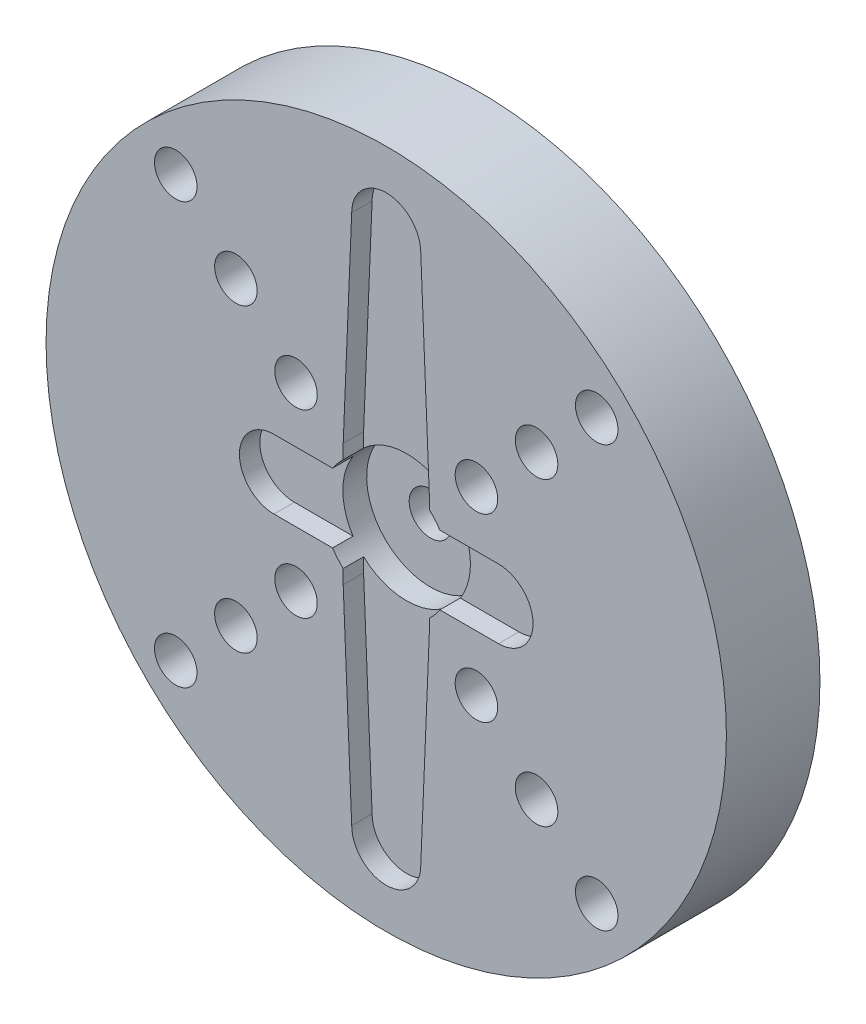
from build123d import *

# Parameters (mm, degrees)
SKETCH1_R               = 20
BOSS_EXTRUDE1_DEPTH     = 4
SKETCH2_R               = 1.25
CUT_EXTRUDE1_DEPTH      = 29.565713714
CAVITY1_START           = 2.8
CAVITY1_OUTLINE_R       = 0.675
CAVITY1_OUTLINE_R_2     = 0.6
CAVITY1_OUTLINE_R_3     = 2.5
CAVITY1_DEPTH           = 1.2
CAVITY1_START_2         = 3.4
CAVITY1_2_OUTLINE_R     = 2.5
CAVITY1_2_OUTLINE_R_2   = 1.25
CAVITY1_2_DEPTH         = 0.6
CUT_EXTRUDE2_START      = -2
CUT_EXTRUDE2_DEPTH      = 2
CUT_EXTRUDE3_START      = -1.2
CUT_EXTRUDE3_DEPTH      = 1.2
CUT_EXTRUDE4_DEPTH      = 1.2
SKETCH6_R               = 1.25
CUT_EXTRUDE5_DEPTH      = 29.565713714
CIRPATTERN1_COUNT       = 4
CUT_EXTRUDE6_DEPTH      = 29.422526278
CUT_EXTRUDE6_DEPTH_BACK = 1.4
SKETCH7_R               = 3.75
SKETCH8_R               = 20
SKETCH8_R_2             = 2.5
SKETCH8_R_3             = 1.25
BOSS_EXTRUDE2_DEPTH     = 1.5


# Read off the part's stored shape, not the designer's step: Cavity1
with BuildPart() as part:
    # Sketch1 → Boss-Extrude1 (new body)
    with BuildSketch(Plane.XY):
        Circle(SKETCH1_R)
    extrude(amount=BOSS_EXTRUDE1_DEPTH)

    # Sketch2 → Cut-Extrude1 (cut, through all)
    with BuildSketch(Plane.XY.offset(4)):
        Circle(SKETCH2_R)
    extrude(amount=-CUT_EXTRUDE1_DEPTH, mode=Mode.SUBTRACT)

    # Cavity1 outline → Cavity1 (cut)
    with BuildSketch(Plane.XY.offset(CAVITY1_START)):
        with BuildLine():
            ThreePointArc((2.993325909, 2), (2.762479071, 2.308399745), (2.5, 2.590366769))
            Line((2.5, 2.590366769), (2.5, 3.6))
            Line((2.5, 3.6), (2, 15.6))
            ThreePointArc((2, 15.6), (0, 17.6), (-2, 15.6))
            Line((-2, 15.6), (-2.5, 3.6))
            Line((-2.5, 3.6), (-2.5, 2.590366769))
            ThreePointArc((-2.5, 2.590366769), (-2.762479071, 2.308399745), (-2.993325909, 2))
            Line((-2.993325909, 2), (-6.6, 2))
            ThreePointArc((-6.6, 2), (-8.6, 0), (-6.6, -2))
            Line((-6.6, -2), (-2.993325909, -2))
            ThreePointArc((-2.993325909, -2), (-2.762479071, -2.308399745), (-2.5, -2.590366769))
            Line((-2.5, -2.590366769), (-2.5, -3.6))
            Line((-2.5, -3.6), (-2, -15.6))
            ThreePointArc((-2, -15.6), (0, -17.6), (2, -15.6))
            Line((2, -15.6), (2.5, -3.6))
            Line((2.5, -3.6), (2.5, -2.590366769))
            ThreePointArc((2.5, -2.590366769), (2.762479071, -2.308399745), (2.993325909, -2))
            Line((2.993325909, -2), (6.6, -2))
            ThreePointArc((6.6, -2), (8.6, 0), (6.6, 2))
            Line((6.6, 2), (2.993325909, 2))
        make_face()
        with Locations((0, -15.6)):
            Circle(CAVITY1_OUTLINE_R, mode=Mode.SUBTRACT)
        with Locations((0, -13.4)):
            Circle(CAVITY1_OUTLINE_R, mode=Mode.SUBTRACT)
        with Locations((0, -11.2)):
            Circle(CAVITY1_OUTLINE_R, mode=Mode.SUBTRACT)
        with Locations((0, -9)):
            Circle(CAVITY1_OUTLINE_R, mode=Mode.SUBTRACT)
        with Locations((0, -6.8)):
            Circle(CAVITY1_OUTLINE_R, mode=Mode.SUBTRACT)
        with Locations((0, -4.6)):
            Circle(CAVITY1_OUTLINE_R, mode=Mode.SUBTRACT)
        with Locations((-6.6, 0)):
            Circle(CAVITY1_OUTLINE_R_2, mode=Mode.SUBTRACT)
        with Locations((-4.6, 0)):
            Circle(CAVITY1_OUTLINE_R_2, mode=Mode.SUBTRACT)
        Circle(CAVITY1_OUTLINE_R_3, mode=Mode.SUBTRACT)
        with Locations((0, 4.6)):
            Circle(CAVITY1_OUTLINE_R, mode=Mode.SUBTRACT)
        with Locations((0, 6.8)):
            Circle(CAVITY1_OUTLINE_R, mode=Mode.SUBTRACT)
        with Locations((4.6, 0)):
            Circle(CAVITY1_OUTLINE_R_2, mode=Mode.SUBTRACT)
        with Locations((6.6, 0)):
            Circle(CAVITY1_OUTLINE_R_2, mode=Mode.SUBTRACT)
        with Locations((0, 9)):
            Circle(CAVITY1_OUTLINE_R, mode=Mode.SUBTRACT)
        with Locations((0, 11.2)):
            Circle(CAVITY1_OUTLINE_R, mode=Mode.SUBTRACT)
        with Locations((0, 13.4)):
            Circle(CAVITY1_OUTLINE_R, mode=Mode.SUBTRACT)
        with Locations((0, 15.6)):
            Circle(CAVITY1_OUTLINE_R, mode=Mode.SUBTRACT)
    extrude(amount=CAVITY1_DEPTH, mode=Mode.SUBTRACT)

    # Cavity1 2 outline → Cavity1 2 (cut)
    with BuildSketch(Plane.XY.offset(CAVITY1_START_2)):
        Circle(CAVITY1_2_OUTLINE_R)
        Circle(CAVITY1_2_OUTLINE_R_2, mode=Mode.SUBTRACT)
    extrude(amount=CAVITY1_2_DEPTH, mode=Mode.SUBTRACT)

    # Sketch3 → Cut-Extrude2 (cut)
    with BuildSketch(Plane.XY.offset(3.4).offset(CUT_EXTRUDE2_START)):
        with BuildLine():
            ThreePointArc((-2.5, 0), (0, -2.5), (2.5, 0))
            ThreePointArc((2.5, 0), (0, 2.5), (-2.5, 0))
        make_face()
    extrude(amount=CUT_EXTRUDE2_DEPTH, mode=Mode.SUBTRACT)

    # Sketch4 → Cut-Extrude3 (cut)
    with BuildSketch(Plane.XY.offset(4).offset(CUT_EXTRUDE3_START)):
        with BuildLine():
            Line((-6.6, -2), (-2.993325909, -2))
            ThreePointArc((-2.993325909, -2), (-2.762479071, -2.308399745), (-2.5, -2.590366769))
            Line((-2.5, -2.590366769), (-2.5, -3.6))
            Line((-2.5, -3.6), (-2, -15.6))
            ThreePointArc((-2, -15.6), (0, -17.6), (2, -15.6))
            Line((2, -15.6), (2.5, -3.6))
            Line((2.5, -3.6), (2.5, -2.590366769))
            ThreePointArc((2.5, -2.590366769), (2.762479071, -2.308399745), (2.993325909, -2))
            Line((2.993325909, -2), (6.6, -2))
            ThreePointArc((6.6, -2), (8.6, 0), (6.6, 2))
            Line((6.6, 2), (2.993325909, 2))
            ThreePointArc((2.993325909, 2), (2.762479071, 2.308399745), (2.5, 2.590366769))
            Line((2.5, 2.590366769), (2.5, 3.6))
            Line((2.5, 3.6), (2, 15.6))
            ThreePointArc((2, 15.6), (0, 17.6), (-2, 15.6))
            Line((-2, 15.6), (-2.5, 3.6))
            Line((-2.5, 3.6), (-2.5, 2.590366769))
            ThreePointArc((-2.5, 2.590366769), (-2.762479071, 2.308399745), (-2.993325909, 2))
            Line((-2.993325909, 2), (-6.6, 2))
            ThreePointArc((-6.6, 2), (-8.6, 0), (-6.6, -2))
        make_face()
    extrude(amount=CUT_EXTRUDE3_DEPTH, mode=Mode.SUBTRACT)

    # Sketch5 → Cut-Extrude4 (cut)
    with BuildSketch(Plane.XY.offset(4)):
        with BuildLine():
            Line((-6.6, -2.03), (-3.00931886, -2.03))
            ThreePointArc((-3.00931886, -2.03), (-2.784441978, -2.328901645), (-2.53, -2.603075105))
            Line((-2.53, -2.603075105), (-2.53, -3.600624729))
            Line((-2.53, -3.600624729), (-2.029999903, -15.600627053))
            ThreePointArc((-2.029999903, -15.600627053), (0, -17.63), (2.029999903, -15.600627053))
            Line((2.029999903, -15.600627053), (2.53, -3.600624729))
            Line((2.53, -3.600624729), (2.53, -2.603075105))
            ThreePointArc((2.53, -2.603075105), (2.784441978, -2.328901645), (3.00931886, -2.03))
            Line((3.00931886, -2.03), (6.6, -2.03))
            ThreePointArc((6.6, -2.03), (8.63, 0), (6.6, 2.03))
            Line((6.6, 2.03), (3.00931886, 2.03))
            ThreePointArc((3.00931886, 2.03), (2.784441978, 2.328901645), (2.53, 2.603075105))
            Line((2.53, 2.603075105), (2.53, 3.600624729))
            Line((2.53, 3.600624729), (2.029999903, 15.600627053))
            ThreePointArc((2.029999903, 15.600627053), (0, 17.63), (-2.029999903, 15.600627053))
            Line((-2.029999903, 15.600627053), (-2.53, 3.600624729))
            Line((-2.53, 3.600624729), (-2.53, 2.603075105))
            ThreePointArc((-2.53, 2.603075105), (-2.784441978, 2.328901645), (-3.00931886, 2.03))
            Line((-3.00931886, 2.03), (-6.6, 2.03))
            ThreePointArc((-6.6, 2.03), (-8.63, 0), (-6.6, -2.03))
        make_face()
    extrude(amount=-CUT_EXTRUDE4_DEPTH, mode=Mode.SUBTRACT)

    # Sketch6 → Cut-Extrude5 (cut, through all)
    with BuildSketch(Plane.XY.offset(4)):
        with Locations((5.303300859, 5.303300859)):
            Circle(SKETCH6_R)
        with Locations((8.838834765, 8.838834765)):
            Circle(SKETCH6_R)
        with Locations((12.374368671, 12.374368671)):
            Circle(SKETCH6_R)
    cut_extrude5 = extrude(amount=-CUT_EXTRUDE5_DEPTH, mode=Mode.SUBTRACT)

    # CirPattern1: Cut-Extrude5 ×4 about axis
    cirpattern1_axis = Axis((0, 0, 0), (0, 0, 1))
    for i in range(1, CIRPATTERN1_COUNT):
        add(cut_extrude5.rotate(cirpattern1_axis, i * 360 / CIRPATTERN1_COUNT), mode=Mode.SUBTRACT)

    # Sketch7 → Cut-Extrude6 (cut, two sides: drawn at the far end of the back side and taken through both)
    with BuildSketch(Plane.XY.offset(2.8).offset(-CUT_EXTRUDE6_DEPTH_BACK)):
        with Locations(Location((0, 0, 0), (0, 0, 147.225549173))):
            Circle(SKETCH7_R)
    extrude(amount=CUT_EXTRUDE6_DEPTH + CUT_EXTRUDE6_DEPTH_BACK, mode=Mode.SUBTRACT)

    # Sketch8 → Boss-Extrude2 (add)
    with BuildSketch(Plane(origin=(0, 0, 0), x_dir=(-1, 0, 0), z_dir=(0, 0, -1))):
        Circle(SKETCH8_R)
        Circle(SKETCH8_R_2, mode=Mode.SUBTRACT)
        with Locations(Location((12.374368671, 12.374368671, 0), (0, 0, 90))):
            Circle(SKETCH8_R_3, mode=Mode.SUBTRACT)
        with Locations(Location((-12.374368671, 12.374368671, 0), (0, 0, 180))):
            Circle(SKETCH8_R_3, mode=Mode.SUBTRACT)
        with Locations(Location((-8.838834765, 8.838834765, 0), (0, 0, 180))):
            Circle(SKETCH8_R_3, mode=Mode.SUBTRACT)
        with Locations(Location((-5.303300859, 5.303300859, 0), (0, 0, 180))):
            Circle(SKETCH8_R_3, mode=Mode.SUBTRACT)
        with Locations((12.374368671, -12.374368671)):
            Circle(SKETCH8_R_3, mode=Mode.SUBTRACT)
        with Locations((8.838834765, -8.838834765)):
            Circle(SKETCH8_R_3, mode=Mode.SUBTRACT)
        with Locations((5.303300859, -5.303300859)):
            Circle(SKETCH8_R_3, mode=Mode.SUBTRACT)
        with Locations(Location((-12.374368671, -12.374368671, 0), (0, 0, 270))):
            Circle(SKETCH8_R_3, mode=Mode.SUBTRACT)
        with Locations(Location((-8.838834765, -8.838834765, 0), (0, 0, 270))):
            Circle(SKETCH8_R_3, mode=Mode.SUBTRACT)
        with Locations(Location((-5.303300859, -5.303300859, 0), (0, 0, 270))):
            Circle(SKETCH8_R_3, mode=Mode.SUBTRACT)
        with Locations(Location((5.303300859, 5.303300859, 0), (0, 0, 90))):
            Circle(SKETCH8_R_3, mode=Mode.SUBTRACT)
        with Locations(Location((8.838834765, 8.838834765, 0), (0, 0, 90))):
            Circle(SKETCH8_R_3, mode=Mode.SUBTRACT)
    extrude(amount=BOSS_EXTRUDE2_DEPTH)


solid = part.part
